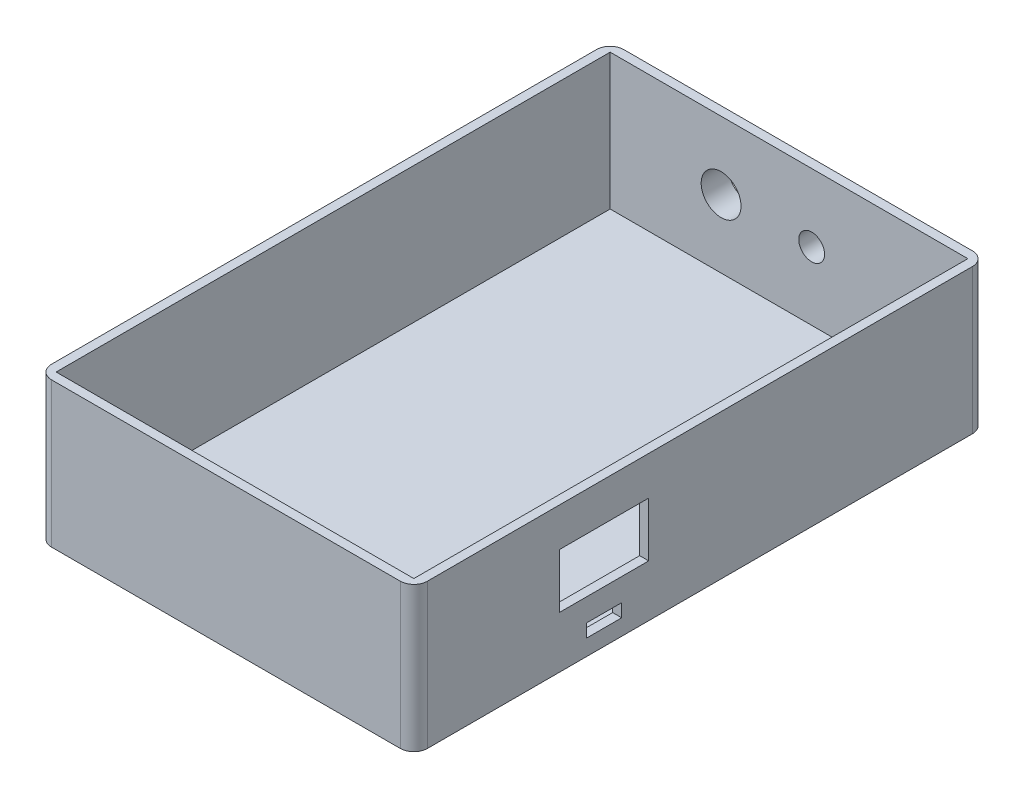
from build123d import *

# Parameters (mm, degrees)
SKETCH1_W           = 83
SKETCH1_H           = 126.35
BOSS_EXTRUDE1_DEPTH = 2
SKETCH2_W           = 83
SKETCH2_H           = 126.35
SKETCH2_W_2         = 79
SKETCH2_H_2         = 122.35
BOSS_EXTRUDE2_DEPTH = 30
SKETCH3_W           = 7.8
SKETCH3_H           = 2.9
SKETCH3_W_2         = 19.74
SKETCH3_H_2         = 12.02
CUT_EXTRUDE1_DEPTH  = 108.59219593
SKETCH4_W           = 2.167162511
SKETCH4_H           = 11.452793886
BOSS_EXTRUDE3_DEPTH = 3
FILLET2_R           = 3
FILLET1_R           = 3
SKETCH6_R           = 4.4
SKETCH6_R_2         = 2.85
CUT_EXTRUDE2_DEPTH  = 135.941366897
SKETCH7_W           = 35
SKETCH7_H           = 15
SKETCH7_W_2         = 33
SKETCH7_H_2         = 13
SKETCH7_R           = 5.4
SKETCH7_R_2         = 4.4
SKETCH7_R_3         = 3.85
SKETCH7_R_4         = 2.85
BOSS_EXTRUDE4_DEPTH = 2
SKETCH8_R           = 3.85
SKETCH8_R_2         = 2.85
SKETCH8_R_3         = 5.4
SKETCH8_R_4         = 4.4
BOSS_EXTRUDE5_DEPTH = 2


with BuildPart() as part:
    # Sketch1 → Boss-Extrude1 (new body)
    with BuildSketch(Plane(origin=(0, 0, 0), x_dir=(1, 0, 0), z_dir=(0, 1, 0))):
        Rectangle(SKETCH1_W, SKETCH1_H)
    extrude(amount=BOSS_EXTRUDE1_DEPTH)

    # Sketch2 → Boss-Extrude2 (add)
    with BuildSketch(Plane(origin=(0, 2, 0), x_dir=(1, 0, 0), z_dir=(0, 1, 0))):
        Rectangle(SKETCH2_W, SKETCH2_H)
        Rectangle(SKETCH2_W_2, SKETCH2_H_2, mode=Mode.SUBTRACT)
    extrude(amount=BOSS_EXTRUDE2_DEPTH)

    # Sketch3 → Cut-Extrude1 (cut, through all)
    with BuildSketch(Plane.ZY.offset(-39.5)):
        with Locations((21.175, 4.99)):
            Rectangle(SKETCH3_W, SKETCH3_H)
        with Locations((21.175, 17.45)):
            Rectangle(SKETCH3_W_2, SKETCH3_H_2)
    extrude(amount=-CUT_EXTRUDE1_DEPTH, mode=Mode.SUBTRACT)

    # Sketch4 → Boss-Extrude3 (add)
    with BuildSketch(Plane(origin=(0, 2, 0), x_dir=(1, 0, 0), z_dir=(0, 1, 0))):
        with Locations((23.516418745, -21.175)):
            Rectangle(SKETCH4_W, SKETCH4_H)
    extrude(amount=BOSS_EXTRUDE3_DEPTH)

    # Fillet2
    fillet2_edges = [part.edges().sort_by_distance(p)[0] for p in [
        (22.432837489, 2, 21.175),
    ]]
    fillet(fillet2_edges, radius=FILLET2_R - 0.0001)  # a hair under: the kernel refuses the full size

    # Fillet1
    fillet1_edges = [part.edges().sort_by_distance(p)[0] for p in [
        (-41.5, 16, -63.175),
        (-41.5, 16, 63.175),
        (41.5, 16, 63.175),
        (41.5, 16, -63.175),
    ]]
    fillet(fillet1_edges, radius=FILLET1_R)

    # Sketch6 → Cut-Extrude2 (cut, through all)
    with BuildSketch(Plane.XY.offset(-61.175)):
        with Locations((-15, 17)):
            Circle(SKETCH6_R)
        with Locations((5, 17)):
            Circle(SKETCH6_R_2)
    extrude(amount=-CUT_EXTRUDE2_DEPTH, mode=Mode.SUBTRACT)

    # Sketch7 → Boss-Extrude4 (add)
    # profile 1 of 3: a face of its own
    with BuildSketch(Plane(origin=(0, 0, -63.175), x_dir=(-1, 0, 0), z_dir=(0, 0, -1))):
        with Locations((4.225, 17)):
            Rectangle(SKETCH7_W, SKETCH7_H)
        with Locations((4.225, 17)):
            Rectangle(SKETCH7_W_2, SKETCH7_H_2, mode=Mode.SUBTRACT)
    # profile 2 of 3: a face of its own
    with BuildSketch(Plane(origin=(0, 0, -63.175), x_dir=(-1, 0, 0), z_dir=(0, 0, -1))):
        with Locations((15, 17)):
            Circle(SKETCH7_R)
        with Locations(Location((15, 17, 0), (0, 0, 180))):
            Circle(SKETCH7_R_2, mode=Mode.SUBTRACT)
    # profile 3 of 3: a face of its own
    with BuildSketch(Plane(origin=(0, 0, -63.175), x_dir=(-1, 0, 0), z_dir=(0, 0, -1))):
        with Locations((-5, 17)):
            Circle(SKETCH7_R_3)
        with Locations(Location((-5, 17, 0), (0, 0, 180))):
            Circle(SKETCH7_R_4, mode=Mode.SUBTRACT)
    extrude(amount=BOSS_EXTRUDE4_DEPTH)

    # Sketch8 → Boss-Extrude5 (add)
    # profile 1 of 2: a face of its own
    with BuildSketch(Plane(origin=(0, 0, -65.175), x_dir=(-1, 0, 0), z_dir=(0, 0, -1))):
        with Locations((-5, 17)):
            Circle(SKETCH8_R)
        with Locations(Location((-5, 17, 0), (0, 0, 180))):
            Circle(SKETCH8_R_2, mode=Mode.SUBTRACT)
    # profile 2 of 2: a face of its own
    with BuildSketch(Plane(origin=(0, 0, -65.175), x_dir=(-1, 0, 0), z_dir=(0, 0, -1))):
        with Locations((15, 17)):
            Circle(SKETCH8_R_3)
        with Locations(Location((15, 17, 0), (0, 0, 180))):
            Circle(SKETCH8_R_4, mode=Mode.SUBTRACT)
    extrude(amount=BOSS_EXTRUDE5_DEPTH)


solid = part.part
